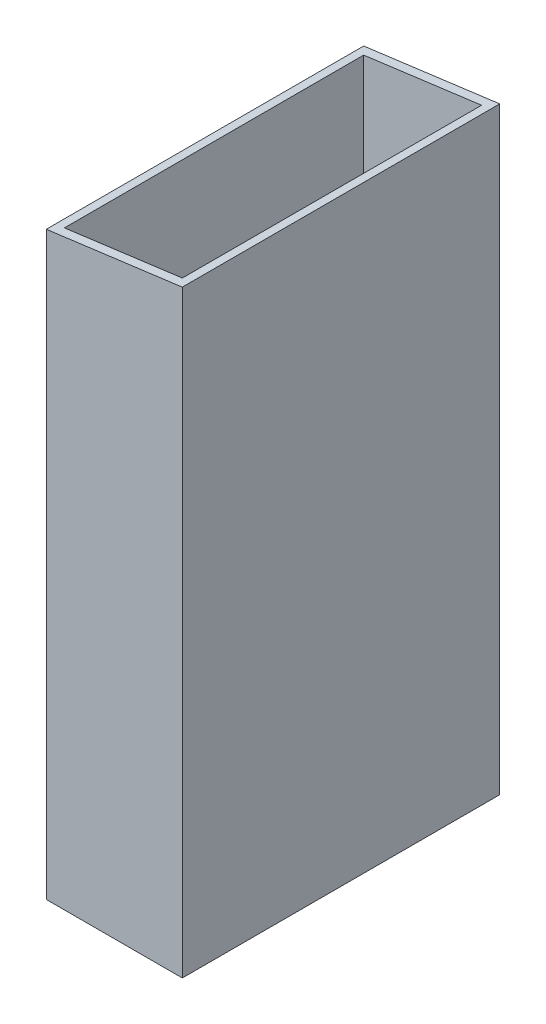
from build123d import *

# Parameters (mm, degrees)
SKETCH_1_W          = 30
SKETCH_1_H          = 750
EXTRUDE_2_DEPTH     = 70
SKETCH_2_W          = 26
SKETCH_2_H          = 66
CUT_EXTRUDE_3_DEPTH = 754.408919512
CUT_EXTRUDE_4_DEPTH = 382.772183376
SKETCH_4_W          = 30
SKETCH_4_H          = 922.920510985
CUT_EXTRUDE_5_DEPTH = 382.772183376


with BuildPart() as part:
    # 草图1 → 凸台-拉伸2 (new body)
    with BuildSketch(Plane.XY):
        Rectangle(SKETCH_1_W, SKETCH_1_H)
    extrude(amount=EXTRUDE_2_DEPTH)

    # 草图2 → 切除-拉伸3 (cut, through all)
    with BuildSketch(Plane.XZ.offset(375)):
        with Locations((0, 35)):
            Rectangle(SKETCH_2_W, SKETCH_2_H)
    extrude(amount=-CUT_EXTRUDE_3_DEPTH, mode=Mode.SUBTRACT)

    # 草图3 → 切除-拉伸4 (cut, through all)
    with BuildSketch(Plane.XY.offset(70)):
        Polygon((-15, 371.050425072), (15, 375), (15, 377.040830045), (-15, 377.040830045), align=None)
        Polygon((15, -375), (15, -347.1), (-15, -343.150425072), (-15, -375), align=None)
    extrude(amount=-CUT_EXTRUDE_4_DEPTH, mode=Mode.SUBTRACT)

    # 草图4 → 切除-拉伸5 (cut, through all)
    with BuildSketch(Plane(origin=(0, 0, 0), x_dir=(-1, 0, 0), z_dir=(0, 0, -1))):
        with Locations((0, -218.40983042)):
            Rectangle(SKETCH_4_W, SKETCH_4_H)
    extrude(amount=-CUT_EXTRUDE_5_DEPTH, mode=Mode.SUBTRACT)


solid = part.part
